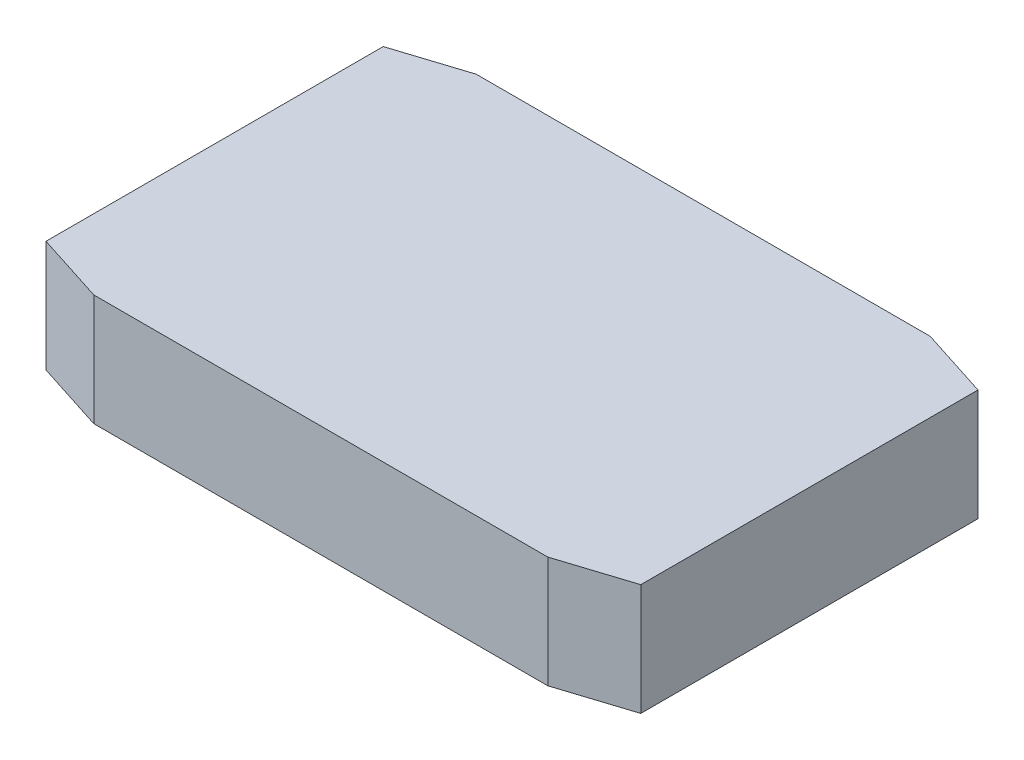
from build123d import *
from OCP.BRepFilletAPI import BRepFilletAPI_MakeChamfer

# Parameters (mm, degrees)
SKETCH1_W           = 224
SKETCH1_H           = 144
BOSS_EXTRUDE1_DEPTH = 42
SKETCH2_W           = 175
SKETCH2_H           = 11
BOSS_EXTRUDE2_DEPTH = 4.5
CHAMFER1_SIZE       = 8.5
CHAMFER1_SIZE2      = 26.5
CHAMFER2_SIZE       = 26.5
CHAMFER2_SIZE2      = 8.5


with BuildPart() as part:
    # Sketch1 → Boss-Extrude1 (new body)
    with BuildSketch(Plane(origin=(0, 0, 0), x_dir=(1, 0, 0), z_dir=(0, 1, 0))):
        with Locations((112, 72)):
            Rectangle(SKETCH1_W, SKETCH1_H)
    extrude(amount=BOSS_EXTRUDE1_DEPTH)

    # Sketch2 → Boss-Extrude2 (add)
    with BuildSketch(Plane.XZ):
        with Locations((112, -15.75)):
            Rectangle(SKETCH2_W, SKETCH2_H)
        with Locations((112, -128.25)):
            Rectangle(SKETCH2_W, SKETCH2_H)
    extrude(amount=BOSS_EXTRUDE2_DEPTH)

    # Chamfer1: one chamfer whose edges measure the first distance from different faces: ONE call of the kernel's chamfer builder (chamfer() names one face for all edges)
    chamfer1_edges_1 = [part.edges().sort_by_distance(p)[0] for p in [
        (0, 21, 0),
    ]]
    chamfer1_side_1 = [part.faces().sort_by_distance(p)[0] for p in [
        (0, 21, -72),
    ]]
    chamfer1_edges_2 = [part.edges().sort_by_distance(p)[0] for p in [
        (224, 21, -144),
    ]]
    chamfer1_side_2 = [part.faces().sort_by_distance(p)[0] for p in [
        (224, 21, -72),
    ]]
    chamfer1 = BRepFilletAPI_MakeChamfer(part.part.solid().wrapped)
    for e in chamfer1_edges_1:
        chamfer1.Add(CHAMFER1_SIZE, CHAMFER1_SIZE2, e.wrapped, chamfer1_side_1[0].wrapped)  # the first distance lies on this face
    for e in chamfer1_edges_2:
        chamfer1.Add(CHAMFER1_SIZE, CHAMFER1_SIZE2, e.wrapped, chamfer1_side_2[0].wrapped)  # the first distance lies on this face
    add(Compound.cast(chamfer1.Shape()), mode=Mode.REPLACE)

    # Chamfer2: one chamfer whose edges measure the first distance from different faces: ONE call of the kernel's chamfer builder (chamfer() names one face for all edges)
    chamfer2_edges_1 = [part.edges().sort_by_distance(p)[0] for p in [
        (0, 21, -144),
    ]]
    chamfer2_side_1 = [part.faces().sort_by_distance(p)[0] for p in [
        (98.75, 21, -144),
    ]]
    chamfer2_edges_2 = [part.edges().sort_by_distance(p)[0] for p in [
        (224, 21, 0),
    ]]
    chamfer2_side_2 = [part.faces().sort_by_distance(p)[0] for p in [
        (125.25, 21, 0),
    ]]
    chamfer2 = BRepFilletAPI_MakeChamfer(part.part.solid().wrapped)
    for e in chamfer2_edges_1:
        chamfer2.Add(CHAMFER2_SIZE, CHAMFER2_SIZE2, e.wrapped, chamfer2_side_1[0].wrapped)  # the first distance lies on this face
    for e in chamfer2_edges_2:
        chamfer2.Add(CHAMFER2_SIZE, CHAMFER2_SIZE2, e.wrapped, chamfer2_side_2[0].wrapped)  # the first distance lies on this face
    add(Compound.cast(chamfer2.Shape()), mode=Mode.REPLACE)


solid = part.part
